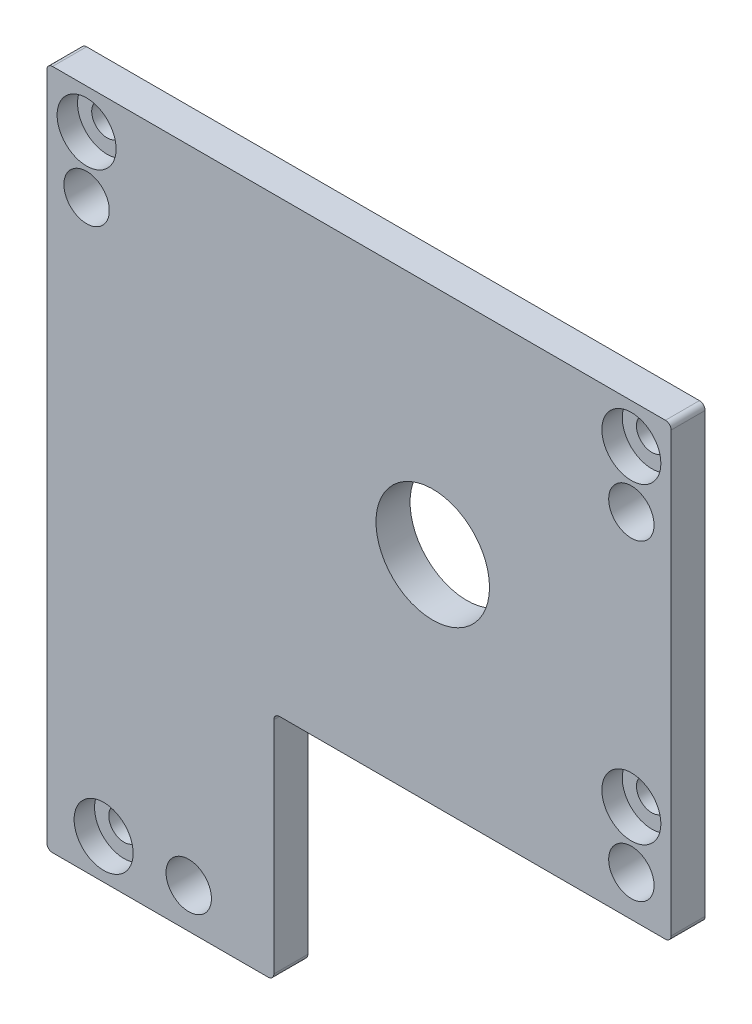
from build123d import *

# Parameters (mm, degrees)
SKETCH_1_W                     = 55
SKETCH_1_H                     = 60
EXTRUDE_1_DEPTH                = 16.5
HOLE_WIZARD_3_6_3_6_1_D        = 3.6
HOLE_WIZARD_3_6_3_6_1_DEPTH    = 25
HOLE_WIZARD_3_6_3_6_1_TIP      = 1.081549114
HOLE_WIZARD_M2_5_1_D           = 2.05
HOLE_WIZARD_M2_5_1_DEPTH       = 14
HOLE_WIZARD_M2_5_1_TIP         = 0.615882135
SKETCH_8_W                     = 35
SKETCH_8_H                     = 20.4
CUT_EXTRUDE_1_DEPTH            = 44.914690025
CUT_EXTRUDE_START              = 2.5
SKETCH_9_W                     = 20
SKETCH_9_H                     = 6
CUT_EXTRUDE_2_DEPTH            = 42.414690025
SHELL_START                    = 1.8
SHELL_1_DEPTH                  = 14.7
EXTRUDE_2_DEPTH                = 3
HOLE_WIZARD_1_AT_2_COUNT       = 2
HOLE_WIZARD_1_AT_2_PITCH       = 48
HOLE_WIZARD_1_AT_3_COUNT       = 2
HOLE_WIZARD_1_AT_3_PITCH       = 27.5
HOLE_WIZARD_1_AT_4_COUNT       = 2
HOLE_WIZARD_1_AT_4_PITCH       = 70.507091842
CUT_EXTRUDE_START_2            = -1.5
SKETCH_15_R                    = 5
SKETCH_15_R_2                  = 1.5
CUT_EXTRUDE_3_DEPTH            = 17.5
SKETCH_16_R                    = 3
CUT_EXTRUDE_4_DEPTH            = 12
CUT_EXTRUDE_5_DEPTH            = 45.379499772
CUT_EXTRUDE_5_DEPTH_BACK       = 45.379499772
SKETCH_17_R                    = 5
FILLET_1_R                     = 0.5
FILLET_2_R                     = 0.5
SKETCH_20_W                    = 2
SKETCH_20_H                    = 3
HOLE_WIZARD_4_0_4_1_AT_2_COUNT = 2
HOLE_WIZARD_4_0_4_1_AT_2_PITCH = 27.5
HOLE_WIZARD_4_0_4_1_AT_3_COUNT = 2
HOLE_WIZARD_4_0_4_1_AT_3_PITCH = 61.846584384
HOLE_WIZARD_4_0_4_1_AT_4_COUNT = 2
HOLE_WIZARD_4_0_4_1_AT_4_PITCH = 48
HOLE_WIZARD_2_7_2_7_1_D        = 2.7


# Read off the part's stored shape, not the designer's step: 抽壳1
with BuildPart() as part:
    # 草图1 → 凸台-拉伸1 (new body)
    with BuildSketch(Plane.XY):
        Rectangle(SKETCH_1_W, SKETCH_1_H)
    extrude(amount=EXTRUDE_1_DEPTH)

    # Ø3.6 (3.6) 直径孔1
    with Locations(Plane.XY.offset(16.5)):
        with Locations((-24, 21.5), (24, 21.5), (24, -6), (-15, -26.5)):
            Hole(HOLE_WIZARD_3_6_3_6_1_D / 2, depth=HOLE_WIZARD_3_6_3_6_1_DEPTH)
            with Locations((0, 0, -(HOLE_WIZARD_3_6_3_6_1_DEPTH + HOLE_WIZARD_3_6_3_6_1_TIP / 2))):  # 118° drill point
                Cone(0, HOLE_WIZARD_3_6_3_6_1_D / 2, HOLE_WIZARD_3_6_3_6_1_TIP, mode=Mode.SUBTRACT)

    # M2.5 螺纹孔1
    with Locations(Plane.XY.offset(16.5)):
        with Locations((-24, 26.5), (24, 26.5), (24, -1), (-22.5, -26.5)):
            Hole(HOLE_WIZARD_M2_5_1_D / 2, depth=HOLE_WIZARD_M2_5_1_DEPTH)
            with Locations((0, 0, -(HOLE_WIZARD_M2_5_1_DEPTH + HOLE_WIZARD_M2_5_1_TIP / 2))):  # 118° drill point
                Cone(0, HOLE_WIZARD_M2_5_1_D / 2, HOLE_WIZARD_M2_5_1_TIP, mode=Mode.SUBTRACT)

    # 草图8 → 切除-拉伸1 (cut, through all)
    with BuildSketch(Plane.XY.offset(16.5)):
        with Locations((10, -19.8)):
            Rectangle(SKETCH_8_W, SKETCH_8_H)
    extrude(amount=-CUT_EXTRUDE_1_DEPTH, mode=Mode.SUBTRACT)

    # 草图9 → 切除-拉伸2 (cut, through all)
    with BuildSketch(Plane(origin=(0, 0, 16.5), x_dir=(-1, 0, 0), z_dir=(0, 0, -1)).offset(CUT_EXTRUDE_START)):
        with Locations((17.5, -27)):
            Rectangle(SKETCH_9_W, SKETCH_9_H)
    extrude(amount=CUT_EXTRUDE_2_DEPTH, mode=Mode.SUBTRACT)

    # 抽壳1 outline → 抽壳1 (cut)
    with BuildSketch(Plane.XY.offset(SHELL_START)):
        with BuildLine():
            ThreePointArc((-21.743758657, 28.2), (-21.182110509, 26.299690696), (-22.006919283, 24.4979375))
            ThreePointArc((-22.006919283, 24.4979375), (-20.910890356, 19.651378458), (-25.7, 18.326673669))
            Line((-25.7, 18.326673669), (-25.7, -22.2))
            Line((-25.7, -22.2), (-9.3, -22.2))
            Line((-9.3, -22.2), (-9.3, -7.8))
            Line((-9.3, -7.8), (20.882308546, -7.8))
            ThreePointArc((20.882308546, -7.8), (20.494996561, -5.178446051), (22.006919283, -3.0020625))
            ThreePointArc((22.006919283, -3.0020625), (21.865811165, 0.8509087), (25.7, 1.256241343))
            Line((25.7, 1.256241343), (25.7, 18.326673669))
            ThreePointArc((25.7, 18.326673669), (20.910890356, 19.651378458), (22.006919283, 24.4979375))
            ThreePointArc((22.006919283, 24.4979375), (21.182110509, 26.299690696), (21.743758657, 28.2))
            Line((21.743758657, 28.2), (-21.743758657, 28.2))
        make_face()
    extrude(amount=SHELL_1_DEPTH, mode=Mode.SUBTRACT)


with BuildPart() as body_2:
    # 草图10 → 凸台-拉伸2 (new body)
    with BuildSketch(Plane.XY.offset(16.5)):
        Polygon((-27.5, -30), (-7.5, -30), (-7.5, -9.6), (27.5, -9.6), (27.5, 30), (-27.5, 30), align=None)
    extrude(amount=EXTRUDE_2_DEPTH)


with BuildPart() as hole_wizard_1_tool:
    # 草图13 → 打孔尺寸(%根据)内六角圆柱头螺钉的类型1 (revolve)
    with BuildSketch(Plane(origin=(24, 26.5, 19.5), x_dir=(0, -1, 0), z_dir=(1, 0, 0))):
        Polygon((0, 0), (0, 19.5), (1.1, 19.5), (1.1, 1.8), (2.6, 1.8), (2.6, 0), align=None)
    hole_wizard_1 = revolve(axis=Axis((24, 26.5, 25.85), (0, 0, -1)))


with BuildPart() as part_1:
    add(part.part)

    # 打孔尺寸(%根据)内六角圆柱头螺钉的类型1: cut by hole_wizard_1_tool
    add(hole_wizard_1_tool.part, mode=Mode.SUBTRACT)


with BuildPart() as body_2_1:
    add(body_2.part)

    # 打孔尺寸(%根据)内六角圆柱头螺钉的类型1: cut by hole_wizard_1_tool
    add(hole_wizard_1_tool.part, mode=Mode.SUBTRACT)


with BuildPart() as hole_wizard_1_at_2_tool:
    # 打孔尺寸(%根据)内六角圆柱头螺钉的类型1 at 2: 打孔尺寸(%根据)内六角圆柱头螺钉的类型1 ×2
    with Locations(*[(-i * HOLE_WIZARD_1_AT_2_PITCH, 0, 0) for i in range(1, HOLE_WIZARD_1_AT_2_COUNT)]):
        add(hole_wizard_1)


with BuildPart() as part_2:
    add(part_1.part)

    # 打孔尺寸(%根据)内六角圆柱头螺钉的类型1 at 2: cut by hole_wizard_1_at_2_tool
    add(hole_wizard_1_at_2_tool.part, mode=Mode.SUBTRACT)


with BuildPart() as body_2_2:
    add(body_2_1.part)

    # 打孔尺寸(%根据)内六角圆柱头螺钉的类型1 at 2: cut by hole_wizard_1_at_2_tool
    add(hole_wizard_1_at_2_tool.part, mode=Mode.SUBTRACT)


with BuildPart() as hole_wizard_1_at_3_tool:
    # 打孔尺寸(%根据)内六角圆柱头螺钉的类型1 at 3: 打孔尺寸(%根据)内六角圆柱头螺钉的类型1 ×2
    with Locations(*[(0, -i * HOLE_WIZARD_1_AT_3_PITCH, 0) for i in range(1, HOLE_WIZARD_1_AT_3_COUNT)]):
        add(hole_wizard_1)


with BuildPart() as part_3:
    add(part_2.part)

    # 打孔尺寸(%根据)内六角圆柱头螺钉的类型1 at 3: cut by hole_wizard_1_at_3_tool
    add(hole_wizard_1_at_3_tool.part, mode=Mode.SUBTRACT)


with BuildPart() as body_2_3:
    add(body_2_2.part)

    # 打孔尺寸(%根据)内六角圆柱头螺钉的类型1 at 3: cut by hole_wizard_1_at_3_tool
    add(hole_wizard_1_at_3_tool.part, mode=Mode.SUBTRACT)


with BuildPart() as hole_wizard_1_at_4_tool:
    # 打孔尺寸(%根据)内六角圆柱头螺钉的类型1 at 4: 打孔尺寸(%根据)内六角圆柱头螺钉的类型1 ×2
    with Locations(*[Vector(-0.6595081258531857, -0.7516974337681476, 0) * (i * HOLE_WIZARD_1_AT_4_PITCH) for i in range(1, HOLE_WIZARD_1_AT_4_COUNT)]):
        add(hole_wizard_1)


with BuildPart() as part_4:
    add(part_3.part)

    # 打孔尺寸(%根据)内六角圆柱头螺钉的类型1 at 4: cut by hole_wizard_1_at_4_tool
    add(hole_wizard_1_at_4_tool.part, mode=Mode.SUBTRACT)


with BuildPart() as body_2_4:
    add(body_2_3.part)

    # 打孔尺寸(%根据)内六角圆柱头螺钉的类型1 at 4: cut by hole_wizard_1_at_4_tool
    add(hole_wizard_1_at_4_tool.part, mode=Mode.SUBTRACT)


with BuildPart() as cut_extrude_3_tool:
    # 草图15 → 切除-拉伸3 (new body)
    with BuildSketch(Plane.XY.offset(1.8).offset(CUT_EXTRUDE_START_2)):
        with Locations((6.5, 9.5)):
            Circle(SKETCH_15_R)
        with Locations((-12.549056621, 13.669345493)):
            Circle(SKETCH_15_R_2)
        with Locations((-17, 1.988630488)):
            Circle(SKETCH_15_R_2)
        with Locations((-17.5, -9)):
            Circle(SKETCH_15_R_2)
    extrude(amount=CUT_EXTRUDE_3_DEPTH)


with BuildPart() as part_5:
    add(part_4.part)

    # 切除-拉伸3: cut by cut_extrude_3_tool
    add(cut_extrude_3_tool.part, mode=Mode.SUBTRACT)

    # 草图16 → 切除-拉伸4 (cut)
    with BuildSketch(Plane(origin=(-7.5, 0, 0), x_dir=(0, 0, -1), z_dir=(1, 0, 0))):
        with Locations(Location((-8, -18, 0), (0, 0, 90))):
            Circle(SKETCH_16_R)
    extrude(amount=-CUT_EXTRUDE_4_DEPTH, mode=Mode.SUBTRACT)


with BuildPart() as body_2_5:
    add(body_2_4.part)

    # 切除-拉伸3: cut by cut_extrude_3_tool
    add(cut_extrude_3_tool.part, mode=Mode.SUBTRACT)


with BuildPart() as cut_extrude_5_tool:
    # 草图17 → 切除-拉伸5 (new, two sides: drawn at the far end of the back side and taken through both)
    with BuildSketch(Plane.XY.offset(1.8).offset(-CUT_EXTRUDE_5_DEPTH_BACK)):
        with Locations((6.5, 9.5)):
            Circle(SKETCH_17_R)
    extrude(amount=CUT_EXTRUDE_5_DEPTH + CUT_EXTRUDE_5_DEPTH_BACK)


with BuildPart() as part_6:
    add(part_5.part)

    # 切除-拉伸5: cut by cut_extrude_5_tool
    add(cut_extrude_5_tool.part, mode=Mode.SUBTRACT)

    # 圆角1
    fillet_1_edges = [part_6.edges().sort_by_distance(p)[0] for p in [
        (-27.5, 3, 0),
        (0, 30, 0),
        (27.5, 10.2, 0),
        (27.5, -9.6, 8.25),
        (-7.5, -16.8, 0),
        (10, -9.6, 0),
        (-7.5, -9.6, 8.25),
        (-7.5, -30, 15.25),
        (-27.5, -30, 15.25),
        (-27.5, 30, 8.25),
        (27.5, 30, 8.25),
        (-17.5, -24, 0),
        (-7.5, -24, 7),
        (-27.5, -24, 7),
    ]]
    fillet(fillet_1_edges, radius=FILLET_1_R)


with BuildPart() as body_2_6:
    add(body_2_5.part)

    # 切除-拉伸5: cut by cut_extrude_5_tool
    add(cut_extrude_5_tool.part, mode=Mode.SUBTRACT)

    # 圆角2
    fillet_2_edges = [body_2_6.edges().sort_by_distance(p)[0] for p in [
        (-27.5, 30, 18),
        (27.5, 30, 18),
        (27.5, -9.6, 18),
        (-7.5, -9.6, 18),
        (-7.5, -30, 18),
        (-27.5, -30, 18),
    ]]
    fillet(fillet_2_edges, radius=FILLET_2_R)

    # 草图20 → Ø4.0 (4) 直径孔1 (revolve, cut)
    with BuildSketch(Plane(origin=(24, 21.5, 16.5), x_dir=(0, 1, 0), z_dir=(1, 0, 0))):
        with Locations((1, 1.5)):
            Rectangle(SKETCH_20_W, SKETCH_20_H)
    hole_wizard_4_0_4_1 = revolve(axis=Axis((24, 21.5, 10.15), (0, 0, 1)), mode=Mode.SUBTRACT)

    # Ø4.0 (4) 直径孔1 at 2: Ø4.0 (4) 直径孔1 ×2
    with Locations(*[(0, -i * HOLE_WIZARD_4_0_4_1_AT_2_PITCH, 0) for i in range(1, HOLE_WIZARD_4_0_4_1_AT_2_COUNT)]):
        add(hole_wizard_4_0_4_1, mode=Mode.SUBTRACT)

    # Ø4.0 (4) 直径孔1 at 3: Ø4.0 (4) 直径孔1 ×2
    with Locations(*[Vector(-0.6305926250944656, -0.7761140001162656, 0) * (i * HOLE_WIZARD_4_0_4_1_AT_3_PITCH) for i in range(1, HOLE_WIZARD_4_0_4_1_AT_3_COUNT)]):
        add(hole_wizard_4_0_4_1, mode=Mode.SUBTRACT)

    # Ø4.0 (4) 直径孔1 at 4: Ø4.0 (4) 直径孔1 ×2
    with Locations(*[(-i * HOLE_WIZARD_4_0_4_1_AT_4_PITCH, 0, 0) for i in range(1, HOLE_WIZARD_4_0_4_1_AT_4_COUNT)]):
        add(hole_wizard_4_0_4_1, mode=Mode.SUBTRACT)

    # Ø2.7 (2.7) 直径孔1 (through all)
    with Locations(Plane.XY.offset(17.7)):
        with Locations((24, 26.5), (24, -1), (-24, 26.5), (-22.5, -26.5)):
            Hole(HOLE_WIZARD_2_7_2_7_1_D / 2)


solid = body_2_6.part
